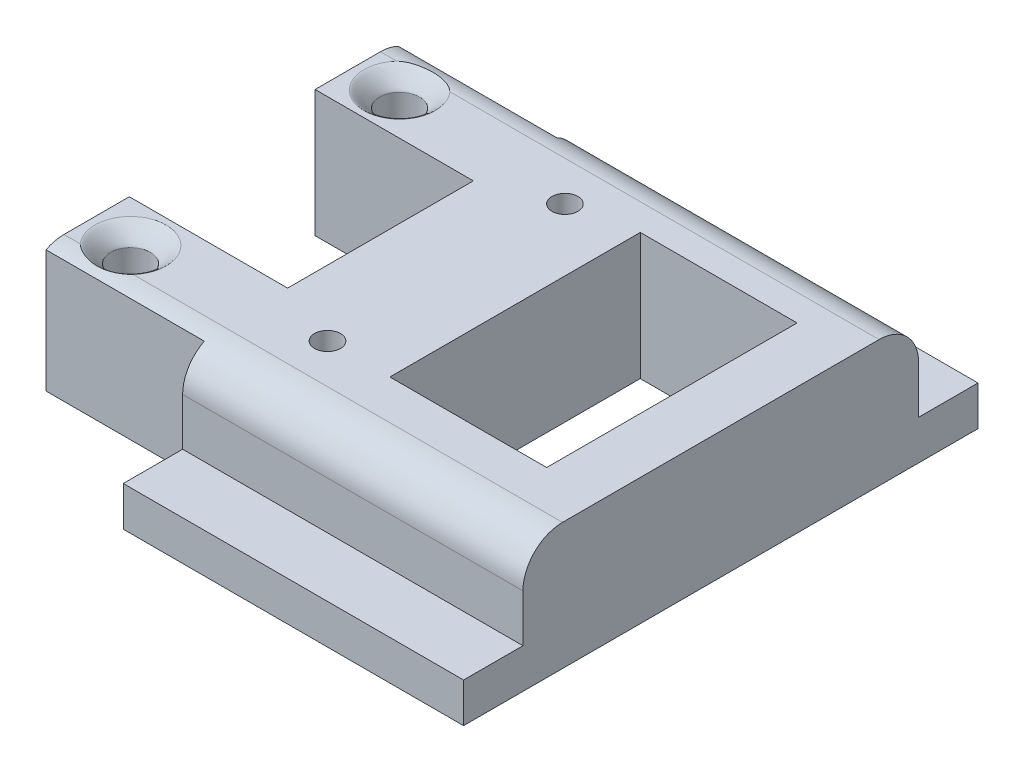
from build123d import *

# Parameters (mm, degrees)
BOSS_EXTRUDE1_DEPTH     = 43
CUT_EXTRUDE6_DEPTH      = 74.561199011
CUT_EXTRUDE6_DEPTH_BACK = 74.561199011
SKETCH8_R               = 1.6383
SKETCH15_W              = 10.528106576
SKETCH15_H              = 16
BOSS_EXTRUDE2_DEPTH     = 20
CUT_EXTRUDE7_DEPTH      = 74.561199011
CUT_EXTRUDE7_DEPTH_BACK = 74.561199011
SKETCH16_R              = 2.5
FILLET5_SIZE            = 2
FILLET6_SIZE            = 2
CUT_EXTRUDE8_DEPTH      = 3.5
FILLET7_R               = 0.5
FILLET8_R               = 0.5
CUT_EXTRUDE9_DEPTH      = 74.561199011
CUT_EXTRUDE9_DEPTH_BACK = 74.561199011
FILLET9_R               = 5


with BuildPart() as part:
    # Sketch1 → Boss-Extrude1 (new body)
    with BuildSketch(Plane(origin=(0, 0, 0), x_dir=(0, 0, -1), z_dir=(1, 0, 0))):
        Polygon((-50, 0), (0, 0), (0, -11), (7.5, -11), (7.5, -16), (-57.5, -16), (-57.5, -11), (-50, -11), align=None)
    extrude(amount=BOSS_EXTRUDE1_DEPTH)

    # Sketch8 → Cut-Extrude6 (cut, two sides: drawn at the far end of the back side and taken through both)
    with BuildSketch(Plane(origin=(0, 0, 0), x_dir=(1, 0, 0), z_dir=(0, 1, 0)).offset(-CUT_EXTRUDE6_DEPTH_BACK)):
        with Locations(Location((8.307443012, -40, 0), (0, 0, 270))):
            Circle(SKETCH8_R)
        with Locations(Location((8.307443012, -10, 0), (0, 0, 270))):
            Circle(SKETCH8_R)
    extrude(amount=CUT_EXTRUDE6_DEPTH + CUT_EXTRUDE6_DEPTH_BACK, mode=Mode.SUBTRACT)

    # Sketch15 → Boss-Extrude2 (add)
    with BuildSketch(Plane.ZY):
        with Locations((42, -8)):
            Rectangle(SKETCH15_W, SKETCH15_H)
        with Locations((8, -8)):
            Rectangle(SKETCH15_W, SKETCH15_H)
    extrude(amount=BOSS_EXTRUDE2_DEPTH)

    # Sketch16 → Cut-Extrude7 (cut, two sides: drawn at the far end of the back side and taken through both)
    with BuildSketch(Plane(origin=(0, 0, 0), x_dir=(1, 0, 0), z_dir=(0, 1, 0)).offset(-CUT_EXTRUDE7_DEPTH_BACK)):
        with Locations(Location((-14.585283135, -8, 0), (0, 0, 270))):
            Circle(SKETCH16_R)
        with Locations(Location((-14.585283135, -42, 0), (0, 0, 90))):
            Circle(SKETCH16_R)
    extrude(amount=CUT_EXTRUDE7_DEPTH + CUT_EXTRUDE7_DEPTH_BACK, mode=Mode.SUBTRACT)

    # Fillet5
    # a fillet whose section is not a circle: 2 mm, written as the material it takes off along each edge
    with BuildSketch(Plane(origin=(-14.585283135, 0, 8), x_dir=(0, 0, 1), z_dir=(-1, 0, 0))) as fillet5_piece_1:
        with BuildLine():
            Bezier((2.5 + FILLET5_SIZE, 0), (2.5, 0), (2.5, -FILLET5_SIZE), weights=[1, 0.141421356, 1])
            Line((2.5, -FILLET5_SIZE), (2.5, 0))
            Line((2.5, 0), (2.5 + FILLET5_SIZE, 0))
        make_face()
    revolve(axis=Axis((-14.585283135, 0, 8), (0, 1, 0)), mode=Mode.SUBTRACT)

    # Fillet6
    # a fillet whose section is not a circle: 2 mm, written as the material it takes off along each edge
    with BuildSketch(Plane(origin=(-14.585283135, 0, 42), x_dir=(0, 0, -1), z_dir=(1, 0, 0))) as fillet6_piece_1:
        with BuildLine():
            Bezier((2.5 + FILLET6_SIZE, 0), (2.5, 0), (2.5, -FILLET6_SIZE), weights=[1, 0.141421356, 1])
            Line((2.5, -FILLET6_SIZE), (2.5, 0))
            Line((2.5, 0), (2.5 + FILLET6_SIZE, 0))
        make_face()
    revolve(axis=Axis((-14.585283135, 0, 42), (0, 1, 0)), mode=Mode.SUBTRACT)

    # Sketch20 → Cut-Extrude8 (cut)
    with BuildSketch(Plane.XZ.offset(16)):
        Polygon((13.503595435, 10), (10.905519224, 14.5), (5.709366801, 14.5), (3.11129059, 10), (5.709366801, 5.5), (10.905519224, 5.5), align=None)
        Polygon((10.905519224, 44.5), (13.503595435, 40), (10.905519224, 35.5), (5.709366801, 35.5), (3.11129059, 40), (5.709366801, 44.5), align=None)
    extrude(amount=-CUT_EXTRUDE8_DEPTH, mode=Mode.SUBTRACT)

    # Fillet7
    fillet7_edges = [part.edges().sort_by_distance(p)[0] for p in [
        (12.204557329, -16, 7.75),
        (12.204557329, -16, 12.25),
        (8.307443012, -16, 14.5),
        (4.410328695, -16, 12.25),
        (4.410328695, -16, 7.75),
        (8.307443012, -16, 5.5),
    ]]
    fillet(fillet7_edges, radius=FILLET7_R)

    # Fillet8
    fillet8_edges = [part.edges().sort_by_distance(p)[0] for p in [
        (8.307443012, -16, 44.5),
        (4.410328695, -16, 42.25),
        (4.410328695, -16, 37.75),
        (8.307443012, -16, 35.5),
        (12.204557329, -16, 37.75),
        (12.204557329, -16, 42.25),
    ]]
    fillet(fillet8_edges, radius=FILLET8_R)

    # Sketch21 → Cut-Extrude9 (cut, two sides: drawn at the far end of the back side and taken through both)
    with BuildSketch(Plane(origin=(0, 0, 0), x_dir=(1, 0, 0), z_dir=(0, 1, 0)).offset(-CUT_EXTRUDE9_DEPTH_BACK)):
        Polygon((16.186241981, -25), (16.186241981, -8.3617), (36, -8.3617), (36, -40), (16.186241981, -40), align=None)
    extrude(amount=CUT_EXTRUDE9_DEPTH + CUT_EXTRUDE9_DEPTH_BACK, mode=Mode.SUBTRACT)

    # Fillet9
    # the kernel refuses this fillet: 5 mm, written as the material it takes off along each edge
    with BuildSketch(Plane(origin=(-30, 0, 50), x_dir=(0, 0, -1), z_dir=(1, 0, 0)), Plane(origin=(-30, 0, 0), x_dir=(0, -1, 0), z_dir=(1, 0, 0))) as fillet9_piece_1:
        with BuildLine():
            CenterArc((FILLET9_R, -FILLET9_R), FILLET9_R, 90, 90)
            Line((0, -FILLET9_R), (-FILLET9_R * 0.02, -FILLET9_R))
            Line((-FILLET9_R * 0.02, -FILLET9_R), (-FILLET9_R * 0.02, FILLET9_R * 0.02))
            Line((-FILLET9_R * 0.02, FILLET9_R * 0.02), (FILLET9_R, FILLET9_R * 0.02))
            Line((FILLET9_R, FILLET9_R * 0.02), (FILLET9_R, 0))
        make_face()
    extrude(amount=103, mode=Mode.SUBTRACT)


solid = part.part
